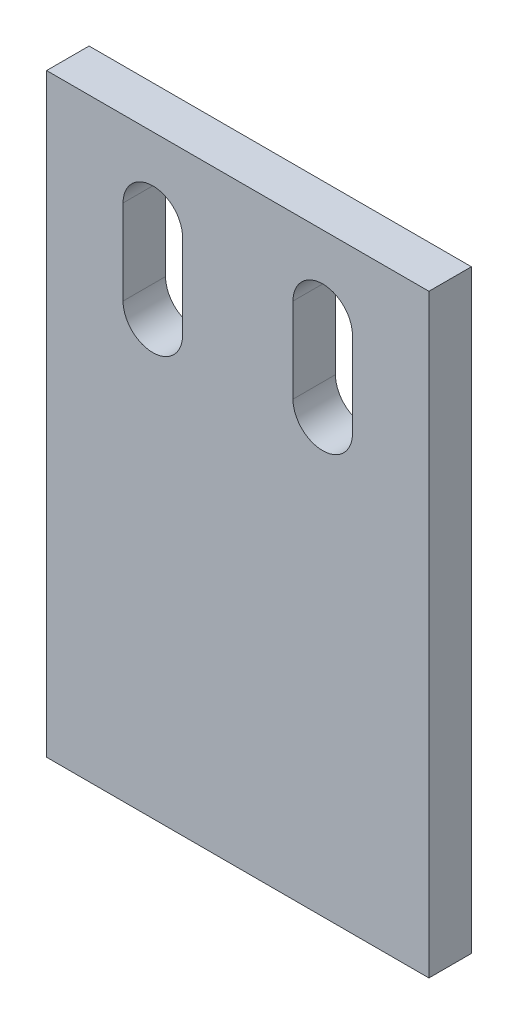
from build123d import *

# Parameters (mm, degrees)
SKETCH_1_W             = 90
SKETCH_1_H             = 140
SM_BASE_FLANGE_1_DEPTH = 10


# Sheet-metal steps are written as plain solids
with BuildPart() as part:
    # Sketch 1 → Базовая кромка1 (new body)
    with BuildSketch(Plane.XY):
        with Locations((45, -70)):
            Rectangle(SKETCH_1_W, SKETCH_1_H)
        with BuildLine():
            Line((32, -18), (32, -38))
            ThreePointArc((32, -38), (25, -45), (18, -38))
            Line((18, -38), (18, -18))
            ThreePointArc((18, -18), (25, -11), (32, -18))
        make_face(mode=Mode.SUBTRACT)
        with BuildLine():
            Line((58, -18), (58, -38))
            ThreePointArc((58, -38), (65, -45), (72, -38))
            Line((72, -38), (72, -18))
            ThreePointArc((72, -18), (65, -11), (58, -18))
        make_face(mode=Mode.SUBTRACT)
    extrude(amount=-SM_BASE_FLANGE_1_DEPTH)


solid = part.part
